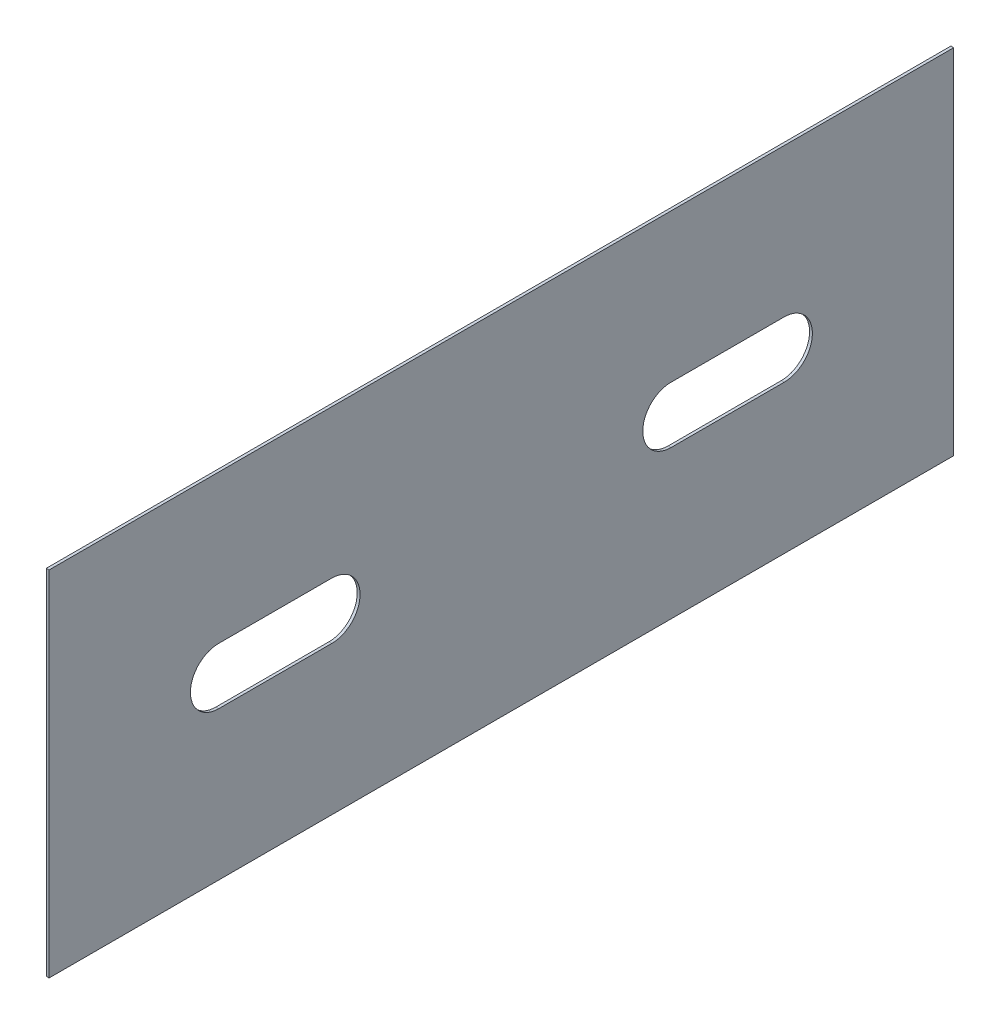
from build123d import *

# Parameters (mm, degrees)
SKETCH1_W           = 640
SKETCH1_H           = 250
BOSS_EXTRUDE1_DEPTH = 2


with BuildPart() as part:
    # Sketch1 → Boss-Extrude1 (new body)
    with BuildSketch(Plane(origin=(0, 0, 0), x_dir=(0, 0, -1), z_dir=(1, 0, 0))):
        with Locations((1.245136187, 10.719844358)):
            Rectangle(SKETCH1_W, SKETCH1_H)
        with BuildLine():
            Line((-198.754863813, 30.719844358), (-118.754863813, 30.719844358))
            ThreePointArc((-118.754863813, 30.719844358), (-98.754863813, 10.719844358), (-118.754863813, -9.280155642))
            Line((-118.754863813, -9.280155642), (-198.754863813, -9.280155642))
            ThreePointArc((-198.754863813, -9.280155642), (-218.754863813, 10.719844358), (-198.754863813, 30.719844358))
        make_face(mode=Mode.SUBTRACT)
        with BuildLine():
            Line((121.245136187, 30.719844358), (201.245136187, 30.719844358))
            ThreePointArc((201.245136187, 30.719844358), (221.245136187, 10.719844358), (201.245136187, -9.280155642))
            Line((201.245136187, -9.280155642), (121.245136187, -9.280155642))
            ThreePointArc((121.245136187, -9.280155642), (101.245136187, 10.719844358), (121.245136187, 30.719844358))
        make_face(mode=Mode.SUBTRACT)
    extrude(amount=BOSS_EXTRUDE1_DEPTH)


solid = part.part
